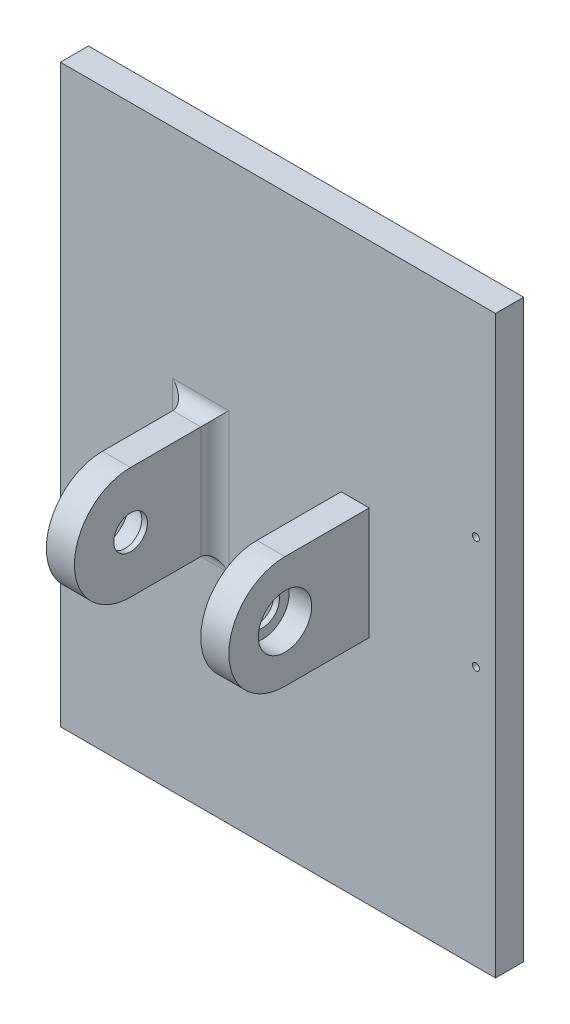
from build123d import *

# Parameters (mm, degrees)
SKETCH_2_W          = 155
SKETCH_2_H          = 205
EXTRUDE_1_DEPTH     = 10
SKETCH_3_W          = 10
SKETCH_3_H          = 40
EXTRUDE_2_DEPTH     = 40
SKETCH_4_R          = 20
EXTRUDE_3_DEPTH     = 10
SKETCH_5_R          = 9.5
CUT_EXTRUDE_1_DEPTH = 8
SKETCH_13_R         = 6
CUT_EXTRUDE_2_DEPTH = 156.261875552
M3X0_5_2_D          = 2.5
FILLET_1_R          = 5


with BuildPart() as part:
    # ｽｹｯﾁ2 → ﾎﾞｽ - 押し出し1 (new body)
    with BuildSketch(Plane.XY):
        Rectangle(SKETCH_2_W, SKETCH_2_H)
    extrude(amount=EXTRUDE_1_DEPTH)

    # ｽｹｯﾁ3 → ﾎﾞｽ - 押し出し2 (add)
    with BuildSketch(Plane.XY):
        with Locations((-27.5, 0)):
            Rectangle(SKETCH_3_W, SKETCH_3_H)
    extrude_2 = extrude(amount=EXTRUDE_2_DEPTH)

    # ｽｹｯﾁ4 → ﾎﾞｽ - 押し出し3 (add)
    with BuildSketch(Plane.ZY.offset(32.5)):
        with Locations((40, 0)):
            Circle(SKETCH_4_R)
    extrude_3 = extrude(amount=-EXTRUDE_3_DEPTH)

    # ｽｹｯﾁ5 → ｶｯﾄ - 押し出し1 (cut)
    with BuildSketch(Plane.ZY.offset(32.5)):
        with Locations((40, 0)):
            Circle(SKETCH_5_R)
    cut_extrude_1 = extrude(amount=-CUT_EXTRUDE_1_DEPTH, mode=Mode.SUBTRACT)

    # ｽｹｯﾁ13 → ｶｯﾄ - 押し出し2 (cut, through all)
    with BuildSketch(Plane(origin=(-22.5, 0, 0), x_dir=(0, 0, -1), z_dir=(1, 0, 0))):
        with Locations((-40, 0)):
            Circle(SKETCH_13_R)
    cut_extrude_2 = extrude(amount=-CUT_EXTRUDE_2_DEPTH, mode=Mode.SUBTRACT)

    # M3x0.5 ねじ穴2 (through all)
    with Locations(Plane.XY.offset(10)):
        with Locations((70.5, -10.000898701), (70.5, 29.999101299)):
            Hole(M3X0_5_2_D / 2)

    # ﾐﾗｰ2: ﾎﾞｽ - 押し出し2, ﾎﾞｽ - 押し出し3, ｶｯﾄ - 押し出し1, ｶｯﾄ - 押し出し2 across plane
    add(extrude_2.mirror(Plane(origin=(0, 0, 0), x_dir=(0, 0, 1), z_dir=(1, 0, 0))))
    add(extrude_3.mirror(Plane(origin=(0, 0, 0), x_dir=(0, 0, 1), z_dir=(1, 0, 0))))
    add(cut_extrude_1.mirror(Plane(origin=(0, 0, 0), x_dir=(0, 0, 1), z_dir=(1, 0, 0))), mode=Mode.SUBTRACT)
    add(cut_extrude_2.mirror(Plane(origin=(0, 0, 0), x_dir=(0, 0, 1), z_dir=(1, 0, 0))), mode=Mode.SUBTRACT)

    # ﾌｨﾚｯﾄ1
    fillet_1_edges = [part.edges().sort_by_distance(p)[0] for p in [
        (-27.5, -20, 10),
        (-32.5, 0, 10),
        (-27.5, 20, 10),
        (-22.5, 0, 10),
    ]]
    fillet(fillet_1_edges, radius=FILLET_1_R)


solid = part.part
